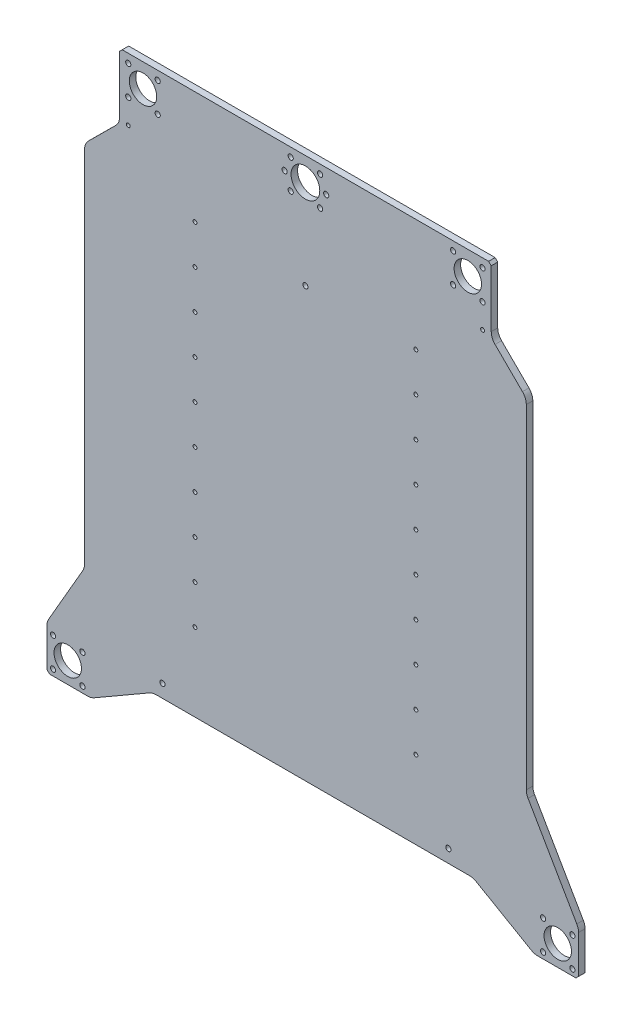
from build123d import *

# Parameters (mm, degrees)
SKETCH1_W           = 170
SKETCH1_H           = 340
BOSS_EXTRUDE1_DEPTH = 5
SKETCH2_R           = 2
CUT_EXTRUDE1_DEPTH  = 241.468293128
SKETCH3_R           = 2
SKETCH3_R_2         = 10.55
SKETCH3_R_3         = 1.5
BOSS_EXTRUDE2_DEPTH = 5
CHAMFER3_SIZE       = 5
FILLET1_R           = 10
CHAMFER2_SIZE       = 2
MIRROR2_OUTLINE_R   = 2
MIRROR2_OUTLINE_R_2 = 1.5
MIRROR2_OUTLINE_R_3 = 10.55
MIRROR2_DEPTH       = 5
SKETCH5_R           = 10.55
SKETCH5_R_2         = 2
BOSS_EXTRUDE3_DEPTH = 5
CHAMFER4_SIZE       = 2
FILLET2_R           = 10
SKETCH4_R           = 1.5
CUT_EXTRUDE2_DEPTH  = 325.221035715


# Read off the part's stored shape, not the designer's step: Mirror2
with BuildPart() as part:
    # Sketch1 → Boss-Extrude1 (new body)
    with BuildSketch(Plane.XY):
        with Locations((-85, 0)):
            Rectangle(SKETCH1_W, SKETCH1_H)
    extrude(amount=BOSS_EXTRUDE1_DEPTH)

    # Sketch2 → Cut-Extrude1 (cut, through all)
    with BuildSketch(Plane.XY.offset(5)):
        with Locations((-110, -160)):
            Circle(SKETCH2_R)
        with Locations((0, 160)):
            Circle(SKETCH2_R)
    extrude(amount=-CUT_EXTRUDE1_DEPTH, mode=Mode.SUBTRACT)

    # Sketch3 → Boss-Extrude2 (add)
    with BuildSketch(Plane.XY.offset(5)):
        with BuildLine():
            Line((-170, 170), (-143, 196.8))
            Line((-143, 196.8), (-143, 246.8))
            Line((-143, 246.8), (0, 246.8))
            Line((0, 246.8), (0, 239.85))
            ThreePointArc((0, 239.85), (-11.05, 228.8), (0, 217.75))
            Line((0, 217.75), (0, 170))
            Line((0, 170), (-170, 170))
        make_face()
        with Locations((-11.313708499, 240.113708499)):
            Circle(SKETCH3_R, mode=Mode.SUBTRACT)
        with Locations((-11.313708499, 217.486291501)):
            Circle(SKETCH3_R, mode=Mode.SUBTRACT)
        with Locations((-16, 228.8)):
            Circle(SKETCH3_R, mode=Mode.SUBTRACT)
        with Locations((-125, 228.8)):
            Circle(SKETCH3_R_2, mode=Mode.SUBTRACT)
        with Locations((-136.313708499, 240.113708499)):
            Circle(SKETCH3_R, mode=Mode.SUBTRACT)
        with Locations((-113.686291501, 240.113708499)):
            Circle(SKETCH3_R, mode=Mode.SUBTRACT)
        with Locations((-136.313708499, 217.486291501)):
            Circle(SKETCH3_R, mode=Mode.SUBTRACT)
        with Locations((-113.686291501, 217.486291501)):
            Circle(SKETCH3_R, mode=Mode.SUBTRACT)
        with Locations((-136.313708499, 198.8)):
            Circle(SKETCH3_R_3, mode=Mode.SUBTRACT)
    extrude(amount=-BOSS_EXTRUDE2_DEPTH)

    # Chamfer3
    chamfer3_edges = [part.edges().sort_by_distance(p)[0] for p in [
        (-170, -170, 2.5),
    ]]
    chamfer(chamfer3_edges, length=CHAMFER3_SIZE)

    # Fillet1
    fillet1_edges = [part.edges().sort_by_distance(p)[0] for p in [
        (-143, 196.8, 2.5),
        (-170, 170, 2.5),
    ]]
    fillet(fillet1_edges, radius=FILLET1_R)

    # Chamfer2
    chamfer2_edges = [part.edges().sort_by_distance(p)[0] for p in [
        (-143, 246.8, 2.5),
    ]]
    chamfer(chamfer2_edges, length=CHAMFER2_SIZE)

    # Mirror2 outline → Mirror2 (add)
    with BuildSketch(Plane.XY):
        with BuildLine():
            Line((0, -170), (165, -170))
            Line((165, -170), (170, -165))
            Line((170, -165), (170, 165.836071225))
            ThreePointArc((170, 165.836071225), (169.231666328, 169.680071331), (167.044732637, 172.933376494))
            Line((167.044732637, 172.933376494), (145.955267363, 193.866623506))
            ThreePointArc((145.955267363, 193.866623506), (143.768333672, 197.119928669), (143, 200.963928775))
            Line((143, 200.963928775), (143, 244.8))
            Line((143, 244.8), (141, 246.8))
            Line((141, 246.8), (0, 246.8))
            Line((0, 246.8), (0, 239.85))
            ThreePointArc((0, 239.85), (11.05, 228.8), (0, 217.75))
            Line((0, 217.75), (0, 162))
            ThreePointArc((0, 162), (2, 160), (0, 158))
            Line((0, 158), (0, -170))
        make_face()
        with Locations((110, -160)):
            Circle(MIRROR2_OUTLINE_R, mode=Mode.SUBTRACT)
        with Locations((11.313708499, 217.486291501)):
            Circle(MIRROR2_OUTLINE_R, mode=Mode.SUBTRACT)
        with Locations((11.313708499, 240.113708499)):
            Circle(MIRROR2_OUTLINE_R, mode=Mode.SUBTRACT)
        with Locations((16, 228.8)):
            Circle(MIRROR2_OUTLINE_R, mode=Mode.SUBTRACT)
        with Locations((113.686291501, 217.486291501)):
            Circle(MIRROR2_OUTLINE_R, mode=Mode.SUBTRACT)
        with Locations((113.686291501, 240.113708499)):
            Circle(MIRROR2_OUTLINE_R, mode=Mode.SUBTRACT)
        with Locations((136.313708499, 198.8)):
            Circle(MIRROR2_OUTLINE_R_2, mode=Mode.SUBTRACT)
        with Locations((136.313708499, 217.486291501)):
            Circle(MIRROR2_OUTLINE_R, mode=Mode.SUBTRACT)
        with Locations((125, 228.8)):
            Circle(MIRROR2_OUTLINE_R_3, mode=Mode.SUBTRACT)
        with Locations((136.313708499, 240.113708499)):
            Circle(MIRROR2_OUTLINE_R, mode=Mode.SUBTRACT)
    extrude(amount=MIRROR2_DEPTH)

    # Sketch5 → Boss-Extrude3 (add)
    # profile 1 of 2: a face of its own
    with BuildSketch(Plane.XY.offset(5)):
        Polygon((-198.9, -163.26), (-198.9, -197.26), (-164.9, -197.26), (-117.684294986, -170), (-170, -113.203731661), align=None)
        with Locations((-182.9, -181.26)):
            Circle(SKETCH5_R, mode=Mode.SUBTRACT)
        with Locations((-194.213708499, -169.946291501)):
            Circle(SKETCH5_R_2, mode=Mode.SUBTRACT)
        with Locations((-171.586291501, -169.946291501)):
            Circle(SKETCH5_R_2, mode=Mode.SUBTRACT)
        with Locations((-171.586291501, -192.573708499)):
            Circle(SKETCH5_R_2, mode=Mode.SUBTRACT)
        with Locations((-194.213708499, -192.573708499)):
            Circle(SKETCH5_R_2, mode=Mode.SUBTRACT)
    # profile 2 of 2: a face of its own
    with BuildSketch(Plane.XY.offset(5)):
        Polygon((176.2, -197.26), (210.2, -197.26), (210.2, -163.26), (170, -93.631557536), (128.984294986, -170), align=None)
        with Locations((194.2, -181.26)):
            Circle(SKETCH5_R, mode=Mode.SUBTRACT)
        with Locations((205.513708499, -192.573708499)):
            Circle(SKETCH5_R_2, mode=Mode.SUBTRACT)
        with Locations((205.513708499, -169.946291501)):
            Circle(SKETCH5_R_2, mode=Mode.SUBTRACT)
        with Locations((182.886291501, -169.946291501)):
            Circle(SKETCH5_R_2, mode=Mode.SUBTRACT)
        with Locations((182.886291501, -192.573708499)):
            Circle(SKETCH5_R_2, mode=Mode.SUBTRACT)
    extrude(amount=-BOSS_EXTRUDE3_DEPTH)

    # Chamfer4
    chamfer4_edges = [part.edges().sort_by_distance(p)[0] for p in [
        (-198.9, -197.26, 2.5),
        (210.2, -197.26, 2.5),
    ]]
    chamfer(chamfer4_edges, length=CHAMFER4_SIZE)

    # Fillet2
    fillet2_edges = [part.edges().sort_by_distance(p)[0] for p in [
        (-198.9, -163.26, 2.5),
        (-170, -113.203731661, 2.5),
        (-117.684294986, -170, 2.5),
        (-164.9, -197.26, 2.5),
        (176.2, -197.26, 2.5),
        (128.984294986, -170, 2.5),
        (170, -93.631557536, 2.5),
        (210.2, -163.26, 2.5),
    ]]
    fillet(fillet2_edges, radius=FILLET2_R)

    # Sketch4 → Cut-Extrude2 (cut, through all)
    with BuildSketch(Plane.XY.offset(5)):
        with Locations((-85, 160)):
            Circle(SKETCH4_R)
        with Locations((-85, 130)):
            Circle(SKETCH4_R)
        with Locations((-85, 100)):
            Circle(SKETCH4_R)
        with Locations((-85, 70)):
            Circle(SKETCH4_R)
        with Locations((-85, 40)):
            Circle(SKETCH4_R)
        with Locations((-85, 10)):
            Circle(SKETCH4_R)
        with Locations((-85, -20)):
            Circle(SKETCH4_R)
        with Locations((-85, -50)):
            Circle(SKETCH4_R)
        with Locations((-85, -80)):
            Circle(SKETCH4_R)
        with Locations((-85, -110)):
            Circle(SKETCH4_R)
    cut_extrude2 = extrude(amount=-CUT_EXTRUDE2_DEPTH, mode=Mode.SUBTRACT)

    # Mirror3: Cut-Extrude2 across plane
    add(cut_extrude2.mirror(Plane(origin=(0, 0, 0), x_dir=(0, 0, 1), z_dir=(1, 0, 0))), mode=Mode.SUBTRACT)


solid = part.part
